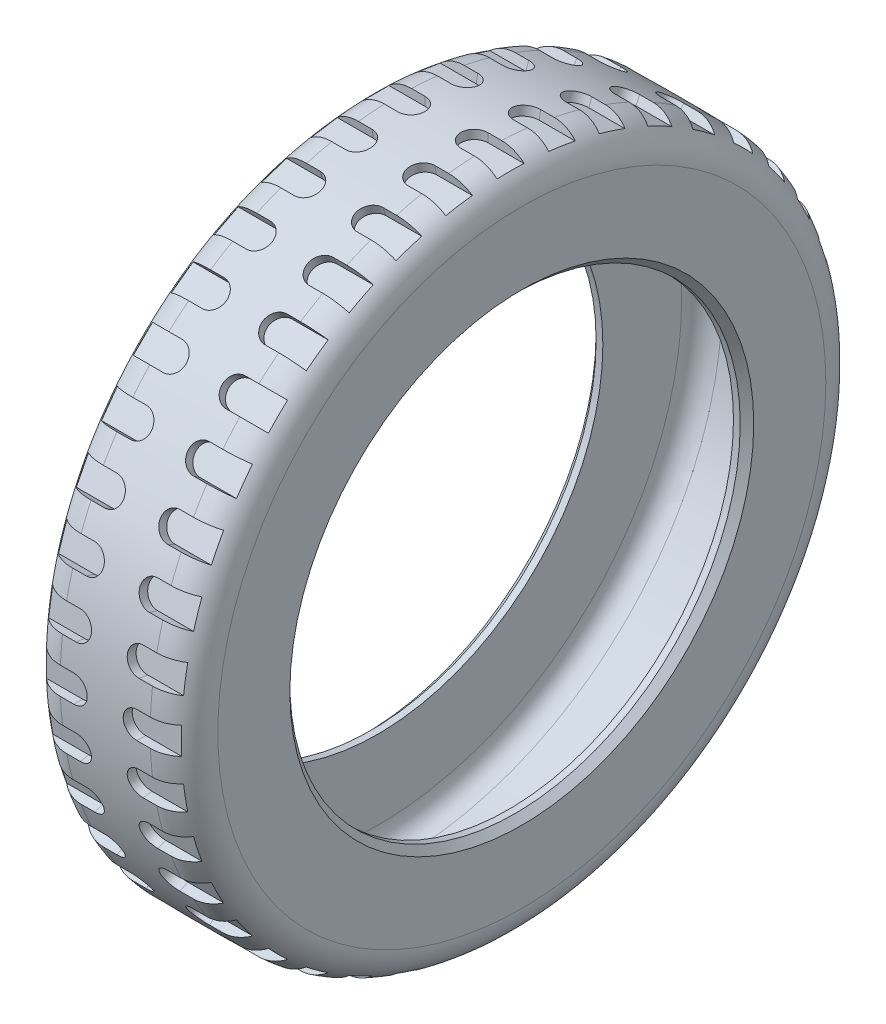
from build123d import *

# Parameters (mm, degrees)
CHAMFER1_SIZE         = 1.5
CUT_EXTRUDE6_DEPTH    = 2
CIRPATTERN1_COUNT     = 40
MIRROR1_COPY_1_DEPTH  = 2
MIRROR1_COPY_2_DEPTH  = 2
MIRROR1_COPY_3_DEPTH  = 2
MIRROR1_COPY_4_DEPTH  = 2
MIRROR1_COPY_5_DEPTH  = 2
MIRROR1_COPY_6_DEPTH  = 2
MIRROR1_COPY_7_DEPTH  = 2
MIRROR1_COPY_8_DEPTH  = 2
MIRROR1_COPY_9_DEPTH  = 2
MIRROR1_COPY_10_DEPTH = 2
MIRROR1_COPY_11_DEPTH = 2
MIRROR1_COPY_12_DEPTH = 2
MIRROR1_COPY_13_DEPTH = 2
MIRROR1_COPY_14_DEPTH = 2
MIRROR1_COPY_15_DEPTH = 2
MIRROR1_COPY_16_DEPTH = 2
MIRROR1_COPY_17_DEPTH = 2
MIRROR1_COPY_18_DEPTH = 2
MIRROR1_COPY_19_DEPTH = 2
MIRROR1_COPY_20_DEPTH = 2
MIRROR1_COPY_21_DEPTH = 2
MIRROR1_COPY_22_DEPTH = 2
MIRROR1_COPY_23_DEPTH = 2
MIRROR1_COPY_24_DEPTH = 2
MIRROR1_COPY_25_DEPTH = 2
MIRROR1_COPY_26_DEPTH = 2
MIRROR1_COPY_27_DEPTH = 2
MIRROR1_COPY_28_DEPTH = 2
MIRROR1_COPY_29_DEPTH = 2
MIRROR1_COPY_30_DEPTH = 2
MIRROR1_COPY_31_DEPTH = 2
MIRROR1_COPY_32_DEPTH = 2
MIRROR1_COPY_33_DEPTH = 2
MIRROR1_COPY_34_DEPTH = 2
MIRROR1_COPY_35_DEPTH = 2
MIRROR1_COPY_36_DEPTH = 2
MIRROR1_COPY_37_DEPTH = 2
MIRROR1_COPY_38_DEPTH = 2
MIRROR1_COPY_39_DEPTH = 2
MIRROR1_COPY_40_DEPTH = 2


with BuildPart() as part:
    # Sketch1 → Revolve1 (revolve)
    with BuildSketch(Plane.XY):
        with BuildLine():
            Line((-17.5, 50), (-17.5, 67.5))
            ThreePointArc((-17.5, 67.5), (-15.303300859, 72.803300859), (-10, 75))
            Line((-10, 75), (10, 75))
            ThreePointArc((10, 75), (15.303300859, 72.803300859), (17.5, 67.5))
            Line((17.5, 67.5), (17.5, 50))
            Line((17.5, 50), (14.5, 50))
            Line((14.5, 50), (14.5, 67.5))
            ThreePointArc((14.5, 67.5), (13.181980515, 70.681980515), (10, 72))
            Line((10, 72), (-10, 72))
            ThreePointArc((-10, 72), (-13.181980515, 70.681980515), (-14.5, 67.5))
            Line((-14.5, 67.5), (-14.5, 50))
            Line((-14.5, 50), (-17.5, 50))
        make_face()
    revolve(axis=Axis((0, 0, 0), (-1, 0, 0)))

    # Chamfer1
    chamfer1_edges = [part.edges().sort_by_distance(p)[0] for p in [
        (-17.5, -50, 0),
        (17.5, -50, 0),
    ]]
    chamfer(chamfer1_edges, length=CHAMFER1_SIZE)

    # Sketch2 → Cut-Extrude6 (cut)
    with BuildSketch(Plane(origin=(0, 75, 0), x_dir=(1, 0, 0), z_dir=(0, 1, 0))):
        with BuildLine():
            Line((7, 3), (15, 3))
            Line((15, 3), (15, -3))
            Line((15, -3), (7, -3))
            ThreePointArc((7, -3), (4, 0), (7, 3))
        make_face()
    cut_extrude6 = extrude(amount=-CUT_EXTRUDE6_DEPTH, mode=Mode.SUBTRACT)

    # CirPattern1: Cut-Extrude6 ×40 about axis
    cirpattern1_axis = Axis((14.5, 0, 0), (1, 0, 0))
    for i in range(1, CIRPATTERN1_COUNT):
        add(cut_extrude6.rotate(cirpattern1_axis, i * 360 / CIRPATTERN1_COUNT), mode=Mode.SUBTRACT)

    # Mirror1 copy 1 sketch → Mirror1 copy 1 (cut)
    with BuildSketch(Plane(origin=(0, 74.076625545, 11.732584878), x_dir=(-1, 0, 0), z_dir=(0, 0.9876883405951378, 0.15643446504023087))):
        with BuildLine():
            Line((7, -3), (15, -3))
            Line((15, -3), (15, 3))
            Line((15, 3), (7, 3))
            ThreePointArc((7, 3), (4, 0), (7, -3))
        make_face()
    extrude(amount=-MIRROR1_COPY_1_DEPTH, mode=Mode.SUBTRACT)

    # Mirror1 copy 2 sketch → Mirror1 copy 2 (cut)
    with BuildSketch(Plane(origin=(0, 71.329238722, 23.176274578), x_dir=(-1, 0, 0), z_dir=(0, 0.9510565162951535, 0.3090169943749474))):
        with BuildLine():
            Line((7, -3), (15, -3))
            Line((15, -3), (15, 3))
            Line((15, 3), (7, 3))
            ThreePointArc((7, 3), (4, 0), (7, -3))
        make_face()
    extrude(amount=-MIRROR1_COPY_2_DEPTH, mode=Mode.SUBTRACT)

    # Mirror1 copy 3 sketch → Mirror1 copy 3 (cut)
    with BuildSketch(Plane(origin=(0, 66.825489314, 34.04928748), x_dir=(-1, 0, 0), z_dir=(0, 0.8910065241883679, 0.45399049973954675))):
        with BuildLine():
            Line((7, -3), (15, -3))
            Line((15, -3), (15, 3))
            Line((15, 3), (7, 3))
            ThreePointArc((7, 3), (4, 0), (7, -3))
        make_face()
    extrude(amount=-MIRROR1_COPY_3_DEPTH, mode=Mode.SUBTRACT)

    # Mirror1 copy 4 sketch → Mirror1 copy 4 (cut)
    with BuildSketch(Plane(origin=(0, 60.676274578, 44.083893922), x_dir=(-1, 0, 0), z_dir=(0, 0.8090169943749475, 0.5877852522924731))):
        with BuildLine():
            Line((7, -3), (15, -3))
            Line((15, -3), (15, 3))
            Line((15, 3), (7, 3))
            ThreePointArc((7, 3), (4, 0), (7, -3))
        make_face()
    extrude(amount=-MIRROR1_COPY_4_DEPTH, mode=Mode.SUBTRACT)

    # Mirror1 copy 5 sketch → Mirror1 copy 5 (cut)
    with BuildSketch(Plane(origin=(0, 53.033008589, 53.033008589), x_dir=(-1, 0, 0), z_dir=(0, 0.7071067811865476, 0.7071067811865475))):
        with BuildLine():
            Line((7, -3), (15, -3))
            Line((15, -3), (15, 3))
            Line((15, 3), (7, 3))
            ThreePointArc((7, 3), (4, 0), (7, -3))
        make_face()
    extrude(amount=-MIRROR1_COPY_5_DEPTH, mode=Mode.SUBTRACT)

    # Mirror1 copy 6 sketch → Mirror1 copy 6 (cut)
    with BuildSketch(Plane(origin=(0, 44.083893922, 60.676274578), x_dir=(-1, 0, 0), z_dir=(0, 0.5877852522924731, 0.8090169943749475))):
        with BuildLine():
            Line((7, -3), (15, -3))
            Line((15, -3), (15, 3))
            Line((15, 3), (7, 3))
            ThreePointArc((7, 3), (4, 0), (7, -3))
        make_face()
    extrude(amount=-MIRROR1_COPY_6_DEPTH, mode=Mode.SUBTRACT)

    # Mirror1 copy 7 sketch → Mirror1 copy 7 (cut)
    with BuildSketch(Plane(origin=(0, 34.04928748, 66.825489314), x_dir=(-1, 0, 0), z_dir=(0, 0.4539904997395468, 0.8910065241883678))):
        with BuildLine():
            Line((7, -3), (15, -3))
            Line((15, -3), (15, 3))
            Line((15, 3), (7, 3))
            ThreePointArc((7, 3), (4, 0), (7, -3))
        make_face()
    extrude(amount=-MIRROR1_COPY_7_DEPTH, mode=Mode.SUBTRACT)

    # Mirror1 copy 8 sketch → Mirror1 copy 8 (cut)
    with BuildSketch(Plane(origin=(0, 23.176274578, 71.329238722), x_dir=(-1, 0, 0), z_dir=(0, 0.30901699437494745, 0.9510565162951535))):
        with BuildLine():
            Line((7, -3), (15, -3))
            Line((15, -3), (15, 3))
            Line((15, 3), (7, 3))
            ThreePointArc((7, 3), (4, 0), (7, -3))
        make_face()
    extrude(amount=-MIRROR1_COPY_8_DEPTH, mode=Mode.SUBTRACT)

    # Mirror1 copy 9 sketch → Mirror1 copy 9 (cut)
    with BuildSketch(Plane(origin=(0, 11.732584878, 74.076625545), x_dir=(-1, 0, 0), z_dir=(0, 0.15643446504023092, 0.9876883405951378))):
        with BuildLine():
            Line((7, -3), (15, -3))
            Line((15, -3), (15, 3))
            Line((15, 3), (7, 3))
            ThreePointArc((7, 3), (4, 0), (7, -3))
        make_face()
    extrude(amount=-MIRROR1_COPY_9_DEPTH, mode=Mode.SUBTRACT)

    # Mirror1 copy 10 sketch → Mirror1 copy 10 (cut)
    with BuildSketch(Plane(origin=(0, 0, 75), x_dir=(-1, 0, 0), z_dir=(0, 0, 1))):
        with BuildLine():
            Line((7, -3), (15, -3))
            Line((15, -3), (15, 3))
            Line((15, 3), (7, 3))
            ThreePointArc((7, 3), (4, 0), (7, -3))
        make_face()
    extrude(amount=-MIRROR1_COPY_10_DEPTH, mode=Mode.SUBTRACT)

    # Mirror1 copy 11 sketch → Mirror1 copy 11 (cut)
    with BuildSketch(Plane(origin=(0, -11.732584878, 74.076625545), x_dir=(-1, 0, 0), z_dir=(0, -0.1564344650402308, 0.9876883405951378))):
        with BuildLine():
            Line((7, -3), (15, -3))
            Line((15, -3), (15, 3))
            Line((15, 3), (7, 3))
            ThreePointArc((7, 3), (4, 0), (7, -3))
        make_face()
    extrude(amount=-MIRROR1_COPY_11_DEPTH, mode=Mode.SUBTRACT)

    # Mirror1 copy 12 sketch → Mirror1 copy 12 (cut)
    with BuildSketch(Plane(origin=(0, -23.176274578, 71.329238722), x_dir=(-1, 0, 0), z_dir=(0, -0.30901699437494734, 0.9510565162951536))):
        with BuildLine():
            Line((7, -3), (15, -3))
            Line((15, -3), (15, 3))
            Line((15, 3), (7, 3))
            ThreePointArc((7, 3), (4, 0), (7, -3))
        make_face()
    extrude(amount=-MIRROR1_COPY_12_DEPTH, mode=Mode.SUBTRACT)

    # Mirror1 copy 13 sketch → Mirror1 copy 13 (cut)
    with BuildSketch(Plane(origin=(0, -34.04928748, 66.825489314), x_dir=(-1, 0, 0), z_dir=(0, -0.4539904997395467, 0.8910065241883679))):
        with BuildLine():
            Line((7, -3), (15, -3))
            Line((15, -3), (15, 3))
            Line((15, 3), (7, 3))
            ThreePointArc((7, 3), (4, 0), (7, -3))
        make_face()
    extrude(amount=-MIRROR1_COPY_13_DEPTH, mode=Mode.SUBTRACT)

    # Mirror1 copy 14 sketch → Mirror1 copy 14 (cut)
    with BuildSketch(Plane(origin=(0, -44.083893922, 60.676274578), x_dir=(-1, 0, 0), z_dir=(0, -0.587785252292473, 0.8090169943749475))):
        with BuildLine():
            Line((7, -3), (15, -3))
            Line((15, -3), (15, 3))
            Line((15, 3), (7, 3))
            ThreePointArc((7, 3), (4, 0), (7, -3))
        make_face()
    extrude(amount=-MIRROR1_COPY_14_DEPTH, mode=Mode.SUBTRACT)

    # Mirror1 copy 15 sketch → Mirror1 copy 15 (cut)
    with BuildSketch(Plane(origin=(0, -53.033008589, 53.033008589), x_dir=(-1, 0, 0), z_dir=(0, -0.7071067811865475, 0.7071067811865476))):
        with BuildLine():
            Line((7, -3), (15, -3))
            Line((15, -3), (15, 3))
            Line((15, 3), (7, 3))
            ThreePointArc((7, 3), (4, 0), (7, -3))
        make_face()
    extrude(amount=-MIRROR1_COPY_15_DEPTH, mode=Mode.SUBTRACT)

    # Mirror1 copy 16 sketch → Mirror1 copy 16 (cut)
    with BuildSketch(Plane(origin=(0, -60.676274578, 44.083893922), x_dir=(-1, 0, 0), z_dir=(0, -0.8090169943749473, 0.5877852522924732))):
        with BuildLine():
            Line((7, -3), (15, -3))
            Line((15, -3), (15, 3))
            Line((15, 3), (7, 3))
            ThreePointArc((7, 3), (4, 0), (7, -3))
        make_face()
    extrude(amount=-MIRROR1_COPY_16_DEPTH, mode=Mode.SUBTRACT)

    # Mirror1 copy 17 sketch → Mirror1 copy 17 (cut)
    with BuildSketch(Plane(origin=(0, -66.825489314, 34.04928748), x_dir=(-1, 0, 0), z_dir=(0, -0.8910065241883678, 0.45399049973954686))):
        with BuildLine():
            Line((7, -3), (15, -3))
            Line((15, -3), (15, 3))
            Line((15, 3), (7, 3))
            ThreePointArc((7, 3), (4, 0), (7, -3))
        make_face()
    extrude(amount=-MIRROR1_COPY_17_DEPTH, mode=Mode.SUBTRACT)

    # Mirror1 copy 18 sketch → Mirror1 copy 18 (cut)
    with BuildSketch(Plane(origin=(0, -71.329238722, 23.176274578), x_dir=(-1, 0, 0), z_dir=(0, -0.9510565162951535, 0.3090169943749475))):
        with BuildLine():
            Line((7, -3), (15, -3))
            Line((15, -3), (15, 3))
            Line((15, 3), (7, 3))
            ThreePointArc((7, 3), (4, 0), (7, -3))
        make_face()
    extrude(amount=-MIRROR1_COPY_18_DEPTH, mode=Mode.SUBTRACT)

    # Mirror1 copy 19 sketch → Mirror1 copy 19 (cut)
    with BuildSketch(Plane(origin=(0, -74.076625545, 11.732584878), x_dir=(-1, 0, 0), z_dir=(0, -0.9876883405951377, 0.15643446504023098))):
        with BuildLine():
            Line((7, -3), (15, -3))
            Line((15, -3), (15, 3))
            Line((15, 3), (7, 3))
            ThreePointArc((7, 3), (4, 0), (7, -3))
        make_face()
    extrude(amount=-MIRROR1_COPY_19_DEPTH, mode=Mode.SUBTRACT)

    # Mirror1 copy 20 sketch → Mirror1 copy 20 (cut)
    with BuildSketch(Plane(origin=(0, -75, 0), x_dir=(-1, 0, 0), z_dir=(0, -1, 0))):
        with BuildLine():
            Line((7, -3), (15, -3))
            Line((15, -3), (15, 3))
            Line((15, 3), (7, 3))
            ThreePointArc((7, 3), (4, 0), (7, -3))
        make_face()
    extrude(amount=-MIRROR1_COPY_20_DEPTH, mode=Mode.SUBTRACT)

    # Mirror1 copy 21 sketch → Mirror1 copy 21 (cut)
    with BuildSketch(Plane(origin=(0, -74.076625545, -11.732584878), x_dir=(-1, 0, 0), z_dir=(0, -0.9876883405951378, -0.15643446504023073))):
        with BuildLine():
            Line((7, -3), (15, -3))
            Line((15, -3), (15, 3))
            Line((15, 3), (7, 3))
            ThreePointArc((7, 3), (4, 0), (7, -3))
        make_face()
    extrude(amount=-MIRROR1_COPY_21_DEPTH, mode=Mode.SUBTRACT)

    # Mirror1 copy 22 sketch → Mirror1 copy 22 (cut)
    with BuildSketch(Plane(origin=(0, -71.329238722, -23.176274578), x_dir=(-1, 0, 0), z_dir=(0, -0.9510565162951536, -0.3090169943749473))):
        with BuildLine():
            Line((7, -3), (15, -3))
            Line((15, -3), (15, 3))
            Line((15, 3), (7, 3))
            ThreePointArc((7, 3), (4, 0), (7, -3))
        make_face()
    extrude(amount=-MIRROR1_COPY_22_DEPTH, mode=Mode.SUBTRACT)

    # Mirror1 copy 23 sketch → Mirror1 copy 23 (cut)
    with BuildSketch(Plane(origin=(0, -66.825489314, -34.04928748), x_dir=(-1, 0, 0), z_dir=(0, -0.8910065241883679, -0.4539904997395467))):
        with BuildLine():
            Line((7, -3), (15, -3))
            Line((15, -3), (15, 3))
            Line((15, 3), (7, 3))
            ThreePointArc((7, 3), (4, 0), (7, -3))
        make_face()
    extrude(amount=-MIRROR1_COPY_23_DEPTH, mode=Mode.SUBTRACT)

    # Mirror1 copy 24 sketch → Mirror1 copy 24 (cut)
    with BuildSketch(Plane(origin=(0, -60.676274578, -44.083893922), x_dir=(-1, 0, 0), z_dir=(0, -0.8090169943749476, -0.587785252292473))):
        with BuildLine():
            Line((7, -3), (15, -3))
            Line((15, -3), (15, 3))
            Line((15, 3), (7, 3))
            ThreePointArc((7, 3), (4, 0), (7, -3))
        make_face()
    extrude(amount=-MIRROR1_COPY_24_DEPTH, mode=Mode.SUBTRACT)

    # Mirror1 copy 25 sketch → Mirror1 copy 25 (cut)
    with BuildSketch(Plane(origin=(0, -53.033008589, -53.033008589), x_dir=(-1, 0, 0), z_dir=(0, -0.7071067811865477, -0.7071067811865475))):
        with BuildLine():
            Line((7, -3), (15, -3))
            Line((15, -3), (15, 3))
            Line((15, 3), (7, 3))
            ThreePointArc((7, 3), (4, 0), (7, -3))
        make_face()
    extrude(amount=-MIRROR1_COPY_25_DEPTH, mode=Mode.SUBTRACT)

    # Mirror1 copy 26 sketch → Mirror1 copy 26 (cut)
    with BuildSketch(Plane(origin=(0, -44.083893922, -60.676274578), x_dir=(-1, 0, 0), z_dir=(0, -0.5877852522924732, -0.8090169943749473))):
        with BuildLine():
            Line((7, -3), (15, -3))
            Line((15, -3), (15, 3))
            Line((15, 3), (7, 3))
            ThreePointArc((7, 3), (4, 0), (7, -3))
        make_face()
    extrude(amount=-MIRROR1_COPY_26_DEPTH, mode=Mode.SUBTRACT)

    # Mirror1 copy 27 sketch → Mirror1 copy 27 (cut)
    with BuildSketch(Plane(origin=(0, -34.04928748, -66.825489314), x_dir=(-1, 0, 0), z_dir=(0, -0.4539904997395469, -0.8910065241883678))):
        with BuildLine():
            Line((7, -3), (15, -3))
            Line((15, -3), (15, 3))
            Line((15, 3), (7, 3))
            ThreePointArc((7, 3), (4, 0), (7, -3))
        make_face()
    extrude(amount=-MIRROR1_COPY_27_DEPTH, mode=Mode.SUBTRACT)

    # Mirror1 copy 28 sketch → Mirror1 copy 28 (cut)
    with BuildSketch(Plane(origin=(0, -23.176274578, -71.329238722), x_dir=(-1, 0, 0), z_dir=(0, -0.30901699437494756, -0.9510565162951535))):
        with BuildLine():
            Line((7, -3), (15, -3))
            Line((15, -3), (15, 3))
            Line((15, 3), (7, 3))
            ThreePointArc((7, 3), (4, 0), (7, -3))
        make_face()
    extrude(amount=-MIRROR1_COPY_28_DEPTH, mode=Mode.SUBTRACT)

    # Mirror1 copy 29 sketch → Mirror1 copy 29 (cut)
    with BuildSketch(Plane(origin=(0, -11.732584878, -74.076625545), x_dir=(-1, 0, 0), z_dir=(0, -0.15643446504023104, -0.9876883405951377))):
        with BuildLine():
            Line((7, -3), (15, -3))
            Line((15, -3), (15, 3))
            Line((15, 3), (7, 3))
            ThreePointArc((7, 3), (4, 0), (7, -3))
        make_face()
    extrude(amount=-MIRROR1_COPY_29_DEPTH, mode=Mode.SUBTRACT)

    # Mirror1 copy 30 sketch → Mirror1 copy 30 (cut)
    with BuildSketch(Plane(origin=(0, 0, -75), x_dir=(-1, 0, 0), z_dir=(0, 0, -1))):
        with BuildLine():
            Line((7, -3), (15, -3))
            Line((15, -3), (15, 3))
            Line((15, 3), (7, 3))
            ThreePointArc((7, 3), (4, 0), (7, -3))
        make_face()
    extrude(amount=-MIRROR1_COPY_30_DEPTH, mode=Mode.SUBTRACT)

    # Mirror1 copy 31 sketch → Mirror1 copy 31 (cut)
    with BuildSketch(Plane(origin=(0, 11.732584878, -74.076625545), x_dir=(-1, 0, 0), z_dir=(0, 0.15643446504023067, -0.9876883405951378))):
        with BuildLine():
            Line((7, -3), (15, -3))
            Line((15, -3), (15, 3))
            Line((15, 3), (7, 3))
            ThreePointArc((7, 3), (4, 0), (7, -3))
        make_face()
    extrude(amount=-MIRROR1_COPY_31_DEPTH, mode=Mode.SUBTRACT)

    # Mirror1 copy 32 sketch → Mirror1 copy 32 (cut)
    with BuildSketch(Plane(origin=(0, 23.176274578, -71.329238722), x_dir=(-1, 0, 0), z_dir=(0, 0.30901699437494723, -0.9510565162951536))):
        with BuildLine():
            Line((7, -3), (15, -3))
            Line((15, -3), (15, 3))
            Line((15, 3), (7, 3))
            ThreePointArc((7, 3), (4, 0), (7, -3))
        make_face()
    extrude(amount=-MIRROR1_COPY_32_DEPTH, mode=Mode.SUBTRACT)

    # Mirror1 copy 33 sketch → Mirror1 copy 33 (cut)
    with BuildSketch(Plane(origin=(0, 34.04928748, -66.825489314), x_dir=(-1, 0, 0), z_dir=(0, 0.45399049973954664, -0.891006524188368))):
        with BuildLine():
            Line((7, -3), (15, -3))
            Line((15, -3), (15, 3))
            Line((15, 3), (7, 3))
            ThreePointArc((7, 3), (4, 0), (7, -3))
        make_face()
    extrude(amount=-MIRROR1_COPY_33_DEPTH, mode=Mode.SUBTRACT)

    # Mirror1 copy 34 sketch → Mirror1 copy 34 (cut)
    with BuildSketch(Plane(origin=(0, 44.083893922, -60.676274578), x_dir=(-1, 0, 0), z_dir=(0, 0.5877852522924729, -0.8090169943749476))):
        with BuildLine():
            Line((7, -3), (15, -3))
            Line((15, -3), (15, 3))
            Line((15, 3), (7, 3))
            ThreePointArc((7, 3), (4, 0), (7, -3))
        make_face()
    extrude(amount=-MIRROR1_COPY_34_DEPTH, mode=Mode.SUBTRACT)

    # Mirror1 copy 35 sketch → Mirror1 copy 35 (cut)
    with BuildSketch(Plane(origin=(0, 53.033008589, -53.033008589), x_dir=(-1, 0, 0), z_dir=(0, 0.7071067811865474, -0.7071067811865477))):
        with BuildLine():
            Line((7, -3), (15, -3))
            Line((15, -3), (15, 3))
            Line((15, 3), (7, 3))
            ThreePointArc((7, 3), (4, 0), (7, -3))
        make_face()
    extrude(amount=-MIRROR1_COPY_35_DEPTH, mode=Mode.SUBTRACT)

    # Mirror1 copy 36 sketch → Mirror1 copy 36 (cut)
    with BuildSketch(Plane(origin=(0, 60.676274578, -44.083893922), x_dir=(-1, 0, 0), z_dir=(0, 0.8090169943749473, -0.5877852522924734))):
        with BuildLine():
            Line((7, -3), (15, -3))
            Line((15, -3), (15, 3))
            Line((15, 3), (7, 3))
            ThreePointArc((7, 3), (4, 0), (7, -3))
        make_face()
    extrude(amount=-MIRROR1_COPY_36_DEPTH, mode=Mode.SUBTRACT)

    # Mirror1 copy 37 sketch → Mirror1 copy 37 (cut)
    with BuildSketch(Plane(origin=(0, 66.825489314, -34.04928748), x_dir=(-1, 0, 0), z_dir=(0, 0.8910065241883678, -0.45399049973954697))):
        with BuildLine():
            Line((7, -3), (15, -3))
            Line((15, -3), (15, 3))
            Line((15, 3), (7, 3))
            ThreePointArc((7, 3), (4, 0), (7, -3))
        make_face()
    extrude(amount=-MIRROR1_COPY_37_DEPTH, mode=Mode.SUBTRACT)

    # Mirror1 copy 38 sketch → Mirror1 copy 38 (cut)
    with BuildSketch(Plane(origin=(0, 71.329238722, -23.176274578), x_dir=(-1, 0, 0), z_dir=(0, 0.9510565162951535, -0.3090169943749476))):
        with BuildLine():
            Line((7, -3), (15, -3))
            Line((15, -3), (15, 3))
            Line((15, 3), (7, 3))
            ThreePointArc((7, 3), (4, 0), (7, -3))
        make_face()
    extrude(amount=-MIRROR1_COPY_38_DEPTH, mode=Mode.SUBTRACT)

    # Mirror1 copy 39 sketch → Mirror1 copy 39 (cut)
    with BuildSketch(Plane(origin=(0, 74.076625545, -11.732584878), x_dir=(-1, 0, 0), z_dir=(0, 0.9876883405951377, -0.15643446504023112))):
        with BuildLine():
            Line((7, -3), (15, -3))
            Line((15, -3), (15, 3))
            Line((15, 3), (7, 3))
            ThreePointArc((7, 3), (4, 0), (7, -3))
        make_face()
    extrude(amount=-MIRROR1_COPY_39_DEPTH, mode=Mode.SUBTRACT)

    # Mirror1 copy 40 sketch → Mirror1 copy 40 (cut)
    with BuildSketch(Plane(origin=(0, 75, 0), x_dir=(-1, 0, 0), z_dir=(0, 1, 0))):
        with BuildLine():
            Line((7, -3), (15, -3))
            Line((15, -3), (15, 3))
            Line((15, 3), (7, 3))
            ThreePointArc((7, 3), (4, 0), (7, -3))
        make_face()
    extrude(amount=-MIRROR1_COPY_40_DEPTH, mode=Mode.SUBTRACT)


solid = part.part
